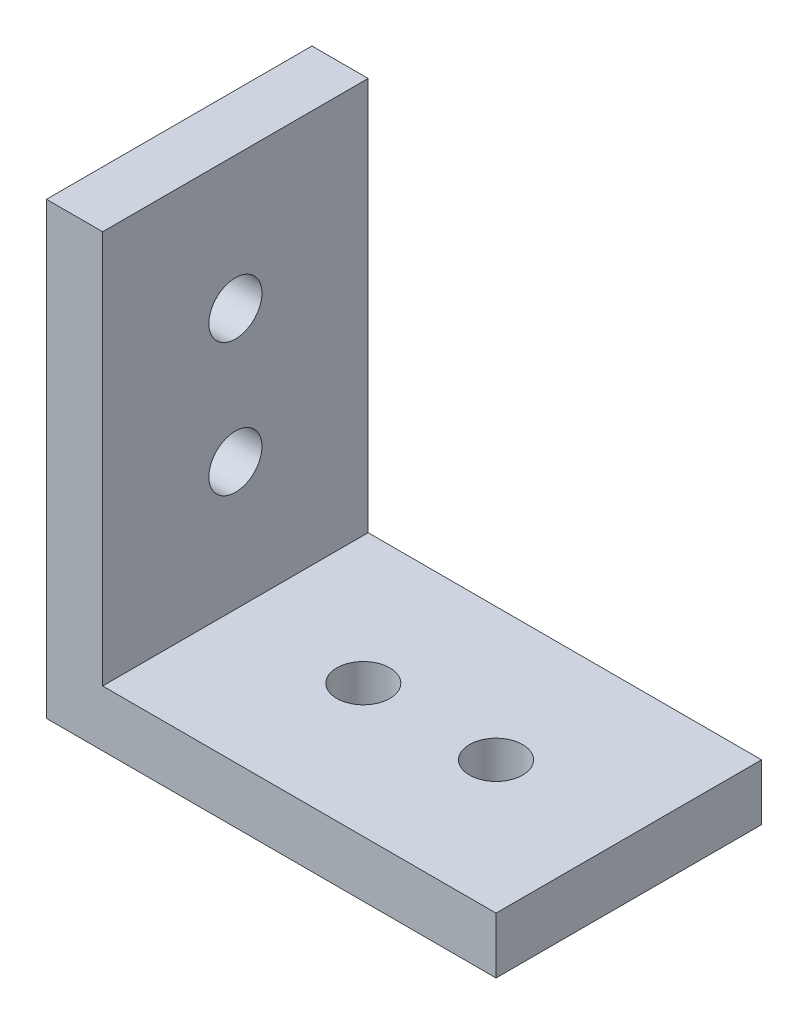
from build123d import *

# Parameters (mm, degrees)
SKETCH1_W           = 15
SKETCH1_H           = 25.4
BOSS_EXTRUDE1_DEPTH = 3.175
SKETCH2_W           = 15
SKETCH2_H           = 3.175
BOSS_EXTRUDE2_DEPTH = 22.225
SKETCH4_R           = 1.5
CUT_EXTRUDE3_DEPTH  = 37.933868265
SKETCH3_R           = 1.5
CUT_EXTRUDE4_DEPTH  = 39.927111375


with BuildPart() as part:
    # Sketch1 → Boss-Extrude1 (new body)
    with BuildSketch(Plane(origin=(0, 0, 0), x_dir=(0, 0, -1), z_dir=(1, 0, 0))):
        with Locations((7.5, 12.7)):
            Rectangle(SKETCH1_W, SKETCH1_H)
    extrude(amount=BOSS_EXTRUDE1_DEPTH)

    # Sketch2 → Boss-Extrude2 (add)
    with BuildSketch(Plane(origin=(3.175, 0, 0), x_dir=(0, 0, -1), z_dir=(1, 0, 0))):
        with Locations((7.5, 1.5875)):
            Rectangle(SKETCH2_W, SKETCH2_H)
    extrude(amount=BOSS_EXTRUDE2_DEPTH)

    # Sketch4 → Cut-Extrude3 (cut, through all)
    with BuildSketch(Plane(origin=(3.175, 0, 0), x_dir=(0, 0, -1), z_dir=(1, 0, 0))):
        with Locations((7.5, 17.9)):
            Circle(SKETCH4_R)
        with Locations((7.5, 10.4)):
            Circle(SKETCH4_R)
    extrude(amount=-CUT_EXTRUDE3_DEPTH, mode=Mode.SUBTRACT)

    # Sketch3 → Cut-Extrude4 (cut, through all)
    with BuildSketch(Plane.XZ):
        with Locations((10.4, -7.5)):
            Circle(SKETCH3_R)
        with Locations((17.9, -7.5)):
            Circle(SKETCH3_R)
    extrude(amount=-CUT_EXTRUDE4_DEPTH, mode=Mode.SUBTRACT)


solid = part.part
